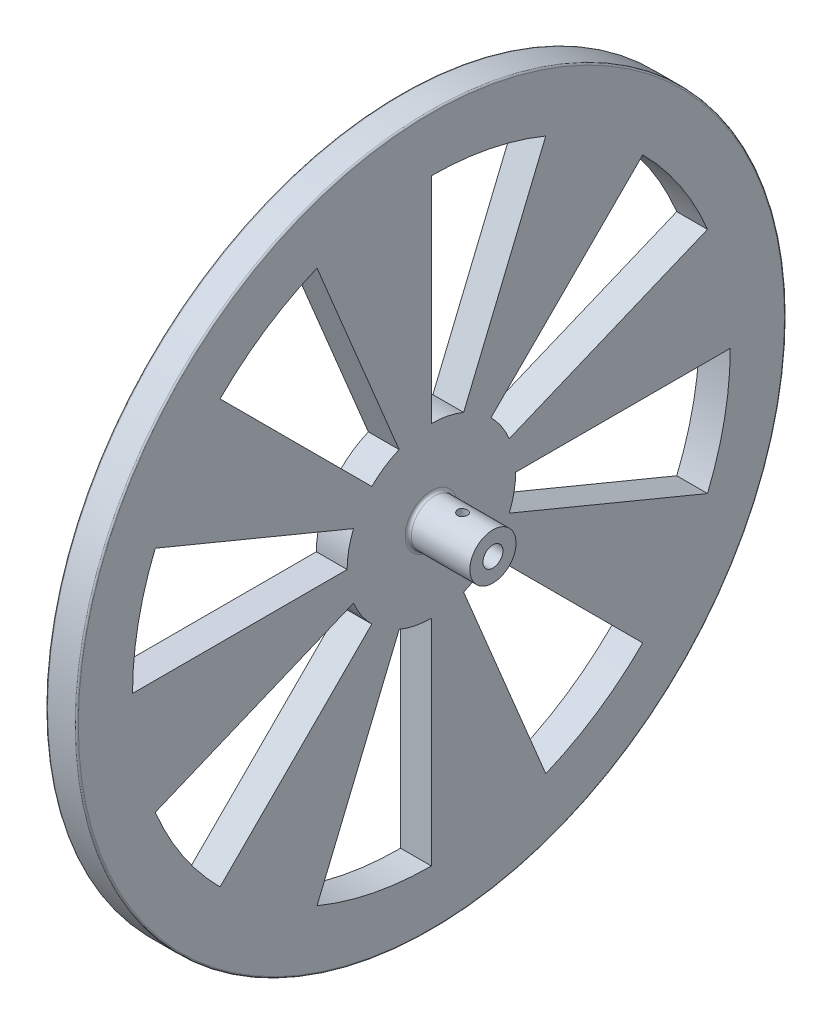
from build123d import *

# Parameters (mm, degrees)
SKETCH1_R           = 115.22
BOSS_EXTRUDE1_DEPTH = 10
FILLET1_R           = 0.5
CUT_EXTRUDE1_DEPTH  = 10
SKETCH3_R           = 7.5
BOSS_EXTRUDE2_DEPTH = 20
FILLET3_R           = 1
SKETCH4_R           = 3.25
CUT_EXTRUDE2_DEPTH  = 20
SKETCH5_R           = 1.6
CUT_EXTRUDE4_DEPTH  = 20


with BuildPart() as part:
    # Sketch1 → Boss-Extrude1 (new body)
    with BuildSketch(Plane(origin=(0, 0, 0), x_dir=(0, 0, -1), z_dir=(1, 0, 0))):
        Circle(SKETCH1_R)
    extrude(amount=BOSS_EXTRUDE1_DEPTH)

    # Fillet1
    fillet1_edges = [part.edges().sort_by_distance(p)[0] for p in [
        (10, 0, 115.22),
        (0, 0, 115.22),
    ]]
    fillet(fillet1_edges, radius=FILLET1_R)

    # Sketch2 → Cut-Extrude1 (cut)
    with BuildSketch(Plane(origin=(10, 0, 0), x_dir=(0, 0, -1), z_dir=(1, 0, 0))):
        with BuildLine():
            Line((-89.710835252, 37.159444653), (-25.292265207, 10.476399272))
            ThreePointArc((-25.292265207, 10.476399272), (-26.850125531, 5.340822034), (-27.376150588, 0))
            Line((-27.376150588, 0), (-97.102308359, 0))
            ThreePointArc((-97.102308359, 0), (-95.236514731, 18.943720606), (-89.710835252, 37.159444653))
        make_face()
        with BuildLine():
            Line((-68.661700709, 68.661700709), (-19.357861723, 19.357861723))
            ThreePointArc((-19.357861723, 19.357861723), (-15.209374361, 22.762437316), (-10.476399272, 25.292265207))
            Line((-10.476399272, 25.292265207), (-37.159444653, 89.710835252))
            ThreePointArc((-37.159444653, 89.710835252), (-53.947152082, 80.737618685), (-68.661700709, 68.661700709))
        make_face()
        with BuildLine():
            Line((0, 97.102308359), (0, 27.376150588))
            ThreePointArc((0, 27.376150588), (5.340822034, 26.850125531), (10.476399272, 25.292265207))
            Line((10.476399272, 25.292265207), (37.159444653, 89.710835252))
            ThreePointArc((37.159444653, 89.710835252), (18.943720606, 95.236514731), (0, 97.102308359))
        make_face()
        with BuildLine():
            Line((68.661700709, 68.661700709), (19.357861723, 19.357861723))
            ThreePointArc((19.357861723, 19.357861723), (22.762437316, 15.209374361), (25.292265207, 10.476399272))
            Line((25.292265207, 10.476399272), (89.710835252, 37.159444653))
            ThreePointArc((89.710835252, 37.159444653), (80.737618685, 53.947152082), (68.661700709, 68.661700709))
        make_face()
        with BuildLine():
            Line((97.102308359, 0), (27.376150588, 0))
            ThreePointArc((27.376150588, 0), (26.850125531, -5.340822034), (25.292265207, -10.476399272))
            Line((25.292265207, -10.476399272), (89.710835252, -37.159444653))
            ThreePointArc((89.710835252, -37.159444653), (95.236514731, -18.943720606), (97.102308359, 0))
        make_face()
        with BuildLine():
            Line((68.661700709, -68.661700709), (19.357861723, -19.357861723))
            ThreePointArc((19.357861723, -19.357861723), (15.209374361, -22.762437316), (10.476399272, -25.292265207))
            Line((10.476399272, -25.292265207), (37.159444653, -89.710835252))
            ThreePointArc((37.159444653, -89.710835252), (53.947152082, -80.737618685), (68.661700709, -68.661700709))
        make_face()
        with BuildLine():
            Line((0, -97.102308359), (0, -27.376150588))
            ThreePointArc((0, -27.376150588), (-5.340822034, -26.850125531), (-10.476399272, -25.292265207))
            Line((-10.476399272, -25.292265207), (-37.159444653, -89.710835252))
            ThreePointArc((-37.159444653, -89.710835252), (-18.943720606, -95.236514731), (0, -97.102308359))
        make_face()
        with BuildLine():
            Line((-68.661700709, -68.661700709), (-19.357861723, -19.357861723))
            ThreePointArc((-19.357861723, -19.357861723), (-22.762437316, -15.209374361), (-25.292265207, -10.476399272))
            Line((-25.292265207, -10.476399272), (-89.710835252, -37.159444653))
            ThreePointArc((-89.710835252, -37.159444653), (-80.737618685, -53.947152082), (-68.661700709, -68.661700709))
        make_face()
    extrude(amount=-CUT_EXTRUDE1_DEPTH, mode=Mode.SUBTRACT)

    # Sketch3 → Boss-Extrude2 (add)
    with BuildSketch(Plane(origin=(10, 0, 0), x_dir=(0, 0, -1), z_dir=(1, 0, 0))):
        Circle(SKETCH3_R)
    extrude(amount=BOSS_EXTRUDE2_DEPTH)

    # Fillet3
    fillet3_edges = [part.edges().sort_by_distance(p)[0] for p in [
        (10, 0, 7.5),
    ]]
    fillet(fillet3_edges, radius=FILLET3_R)

    # Sketch4 → Cut-Extrude2 (cut)
    with BuildSketch(Plane(origin=(30, 0, 0), x_dir=(0, 0, -1), z_dir=(1, 0, 0))):
        Circle(SKETCH4_R)
    extrude(amount=-CUT_EXTRUDE2_DEPTH, mode=Mode.SUBTRACT)

    # Sketch5 → Cut-Extrude4 (cut)
    with BuildSketch(Plane(origin=(0, 0, 0), x_dir=(1, 0, 0), z_dir=(0, 1, 0))):
        with Locations((20.158087078, 0)):
            Circle(SKETCH5_R)
    extrude(amount=CUT_EXTRUDE4_DEPTH, mode=Mode.SUBTRACT)


solid = part.part
